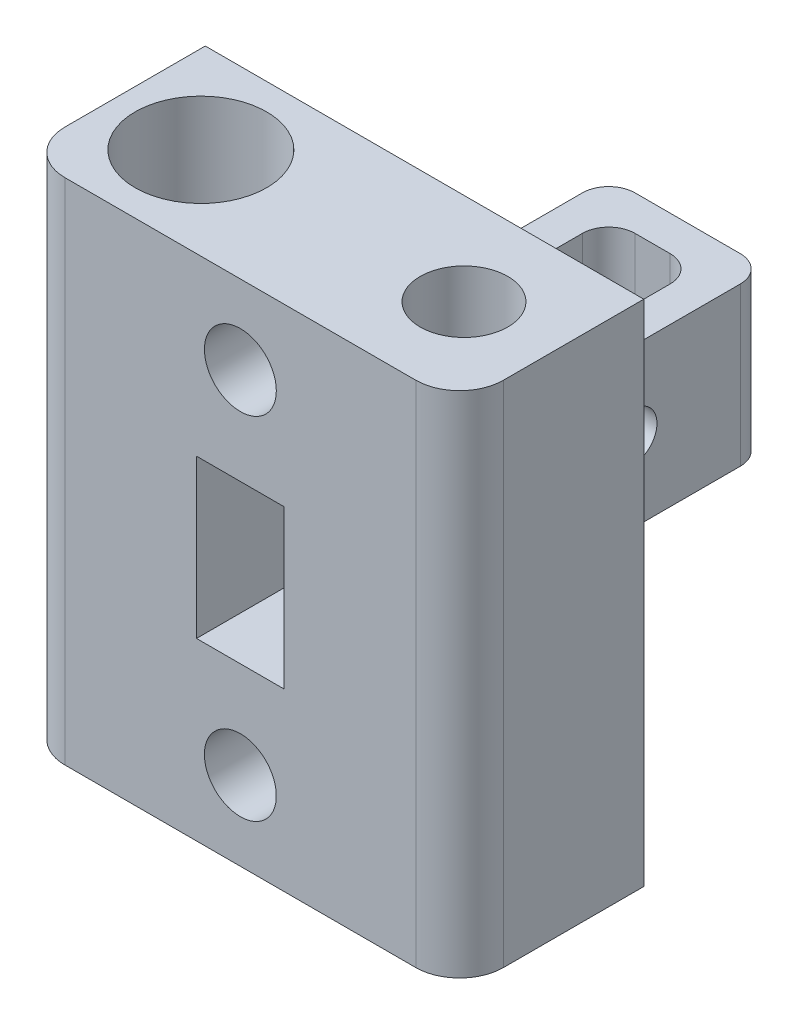
from build123d import *

# Parameters (mm, degrees)
SKETCH1_W           = 50
SKETCH1_H           = 21
BOSS_EXTRUDE1_DEPTH = 58
SKETCH3_R           = 7.5
CUT_EXTRUDE1_DEPTH  = 24
CUT_EXTRUDE2_REACH  = 66.025
SKETCH4_R           = 5
CUT_EXTRUDE3_START  = -24
SKETCH5_R           = 7.5
CUT_EXTRUDE3_DEPTH  = 24
CUT_EXTRUDE4_REACH  = 66.025
SKETCH6_R           = 4.5
CUT_EXTRUDE5_REACH  = 68.558
SKETCH8_W           = 10
SKETCH8_H           = 18
SKETCH7_R           = 4.1
CUT_EXTRUDE6_DEPTH  = 15
SKETCH11_W          = 4
SKETCH11_H          = 18
BOSS_EXTRUDE2_DEPTH = 26
SKETCH12_W          = 18
SKETCH12_H          = 18
BOSS_EXTRUDE3_DEPTH = 4
CUT_EXTRUDE7_DEPTH  = 79.487260113
FILLET1_R           = 5
FILLET2_R           = 5
FILLET3_R           = 3
SKETCH14_R          = 1.95
CUT_EXTRUDE8_DEPTH  = 10


with BuildPart() as part:
    # Sketch1 → Boss-Extrude1 (new body)
    with BuildSketch(Plane(origin=(0, 0, 0), x_dir=(1, 0, 0), z_dir=(0, 1, 0))):
        Rectangle(SKETCH1_W, SKETCH1_H)
    extrude(amount=BOSS_EXTRUDE1_DEPTH)

    # Sketch3 → Cut-Extrude1 (cut)
    with BuildSketch(Plane(origin=(0, 58, 0), x_dir=(1, 0, 0), z_dir=(0, 1, 0))):
        with Locations((-15, 0)):
            Circle(SKETCH3_R)
    extrude(amount=-CUT_EXTRUDE1_DEPTH, mode=Mode.SUBTRACT)

    # Sketch4 → Cut-Extrude2 (cut, up to next)
    with BuildSketch(Plane(origin=(0, 58, 0), x_dir=(1, 0, 0), z_dir=(0, 1, 0)), mode=Mode.PRIVATE) as cut_extrude2_sk1:
        with Locations((15, 0)):
            Circle(SKETCH4_R)
    cut_extrude2_tool1 = extrude(cut_extrude2_sk1.sketch, amount=-CUT_EXTRUDE2_REACH, mode=Mode.PRIVATE) & part.part
    add(cut_extrude2_tool1.solids().sort_by_distance((15, 58, 0))[0], mode=Mode.SUBTRACT)

    # Sketch5 → Cut-Extrude3 (cut)
    with BuildSketch(Plane.XZ.offset(CUT_EXTRUDE3_START)):
        with Locations((-15, 0)):
            Circle(SKETCH5_R)
    extrude(amount=CUT_EXTRUDE3_DEPTH, mode=Mode.SUBTRACT)

    # Sketch6 → Cut-Extrude4 (cut, up to next)
    with BuildSketch(Plane.XZ, mode=Mode.PRIVATE) as cut_extrude4_sk1:
        with Locations((-15, 0)):
            Circle(SKETCH6_R)
    cut_extrude4_tool1 = extrude(cut_extrude4_sk1.sketch, amount=-CUT_EXTRUDE4_REACH, mode=Mode.PRIVATE) & part.part
    add(cut_extrude4_tool1.solids().sort_by_distance((-15, 0, 0))[0], mode=Mode.SUBTRACT)

    # Sketch8 → Cut-Extrude5 (cut, up to next)
    with BuildSketch(Plane.XY.offset(10.5), mode=Mode.PRIVATE) as cut_extrude5_sk1:
        with Locations((0, 29)):
            Rectangle(SKETCH8_W, SKETCH8_H)
    cut_extrude5_tool1 = extrude(cut_extrude5_sk1.sketch, amount=-CUT_EXTRUDE5_REACH, mode=Mode.PRIVATE) & part.part
    add(cut_extrude5_tool1.solids().sort_by_distance((0, 29, 10.5))[0], mode=Mode.SUBTRACT)

    # Sketch7 → Cut-Extrude6 (cut)
    with BuildSketch(Plane.XY.offset(10.5)):
        with Locations((0, 49)):
            Circle(SKETCH7_R)
        with Locations((0, 9)):
            Circle(SKETCH7_R)
    extrude(amount=-CUT_EXTRUDE6_DEPTH, mode=Mode.SUBTRACT)

    # Sketch11 → Boss-Extrude2 (add)
    with BuildSketch(Plane(origin=(0, 0, -10.5), x_dir=(-1, 0, 0), z_dir=(0, 0, -1))):
        with Locations((7, 29)):
            Rectangle(SKETCH11_W, SKETCH11_H)
        with Locations((-7, 29)):
            Rectangle(SKETCH11_W, SKETCH11_H)
    extrude(amount=BOSS_EXTRUDE2_DEPTH)

    # Sketch12 → Boss-Extrude3 (add)
    with BuildSketch(Plane(origin=(0, 0, -36.5), x_dir=(-1, 0, 0), z_dir=(0, 0, -1))):
        with Locations((0, 29)):
            Rectangle(SKETCH12_W, SKETCH12_H)
    extrude(amount=BOSS_EXTRUDE3_DEPTH)

    # Sketch13 → Cut-Extrude7 (cut, through all)
    with BuildSketch(Plane(origin=(9, 0, 0), x_dir=(0, 0, -1), z_dir=(1, 0, 0))):
        with BuildLine():
            Line((16.25, 31.75), (25.25, 31.75))
            ThreePointArc((25.25, 31.75), (28, 29), (25.25, 26.25))
            Line((25.25, 26.25), (16.25, 26.25))
            ThreePointArc((16.25, 26.25), (13.5, 29), (16.25, 31.75))
        make_face()
    extrude(amount=-CUT_EXTRUDE7_DEPTH, mode=Mode.SUBTRACT)

    # Fillet1
    fillet1_edges = [part.edges().sort_by_distance(p)[0] for p in [
        (-25, 29, 10.5),
        (25, 29, 10.5),
    ]]
    fillet(fillet1_edges, radius=FILLET1_R)

    # Fillet2
    fillet2_edges = [part.edges().sort_by_distance(p)[0] for p in [
        (-7, 20, -10.5),
        (7, 20, -10.5),
        (-7, 38, -10.5),
        (7, 38, -10.5),
    ]]
    fillet(fillet2_edges, radius=FILLET2_R)

    # Fillet3
    fillet3_edges = [part.edges().sort_by_distance(p)[0] for p in [
        (-5, 29, -36.5),
        (5, 29, -36.5),
        (-9, 29, -40.5),
        (9, 29, -40.5),
    ]]
    fillet(fillet3_edges, radius=FILLET3_R)

    # Sketch14 → Cut-Extrude8 (cut)
    with BuildSketch(Plane.XZ):
        with Locations((20.550788232, 5.550788232)):
            Circle(SKETCH14_R)
        with Locations((9.449211768, -5.550788232)):
            Circle(SKETCH14_R)
    extrude(amount=-CUT_EXTRUDE8_DEPTH, mode=Mode.SUBTRACT)


solid = part.part
